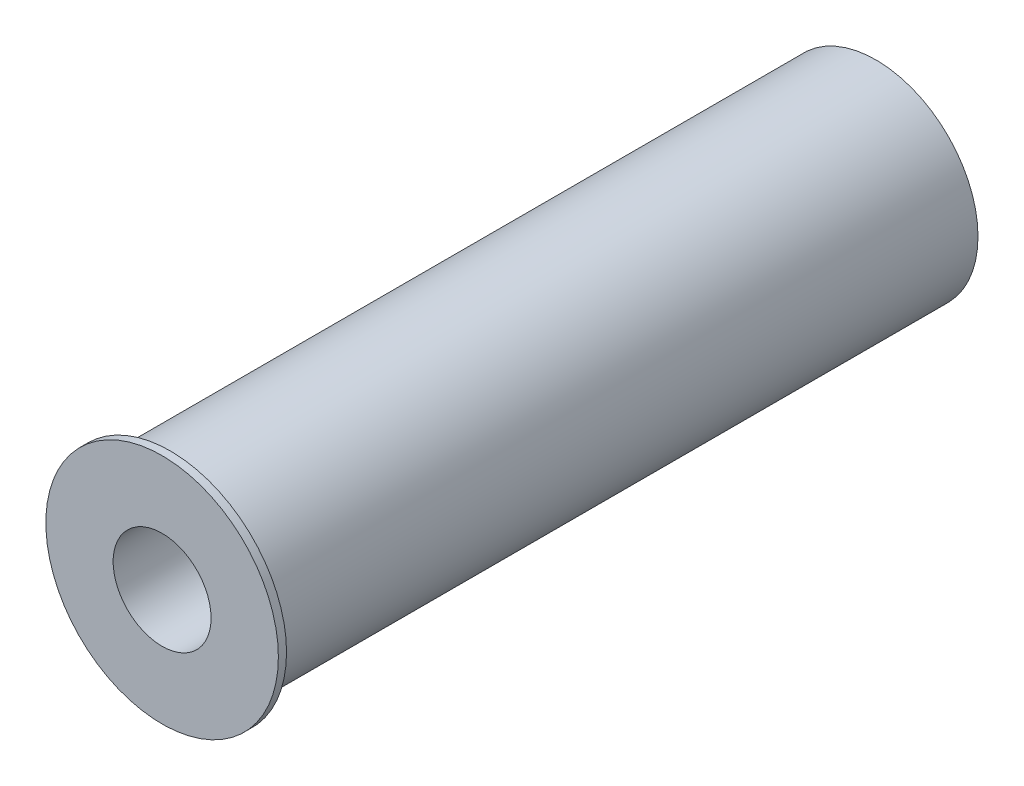
from build123d import *

# Parameters (mm, degrees)
SKIZZE1_R                       = 12.5
SKIZZE1_R_2                     = 6
AUFSATZ_LINEAR_AUSTRAGEN1_DEPTH = 86.5
SKIZZE2_R                       = 14.25
SKIZZE2_R_2                     = 6
AUFSATZ_LINEAR_AUSTRAGEN2_DEPTH = 1
SKIZZE3_R                       = 1.65
SCHNITT_LINEAR_AUSTRAGEN1_DEPTH = 15


with BuildPart() as part:
    # Skizze1 → Aufsatz-Linear austragen1 (new body)
    with BuildSketch(Plane.XY):
        Circle(SKIZZE1_R)
        Circle(SKIZZE1_R_2, mode=Mode.SUBTRACT)
    extrude(amount=AUFSATZ_LINEAR_AUSTRAGEN1_DEPTH)

    # Skizze2 → Aufsatz-Linear austragen2 (add)
    with BuildSketch(Plane.XY.offset(86.5)):
        Circle(SKIZZE2_R)
        Circle(SKIZZE2_R_2, mode=Mode.SUBTRACT)
    extrude(amount=AUFSATZ_LINEAR_AUSTRAGEN2_DEPTH)

    # Skizze3 → Schnitt-Linear austragen1 (cut)
    with BuildSketch(Plane(origin=(0, 0, 0), x_dir=(-1, 0, 0), z_dir=(0, 0, -1))):
        with Locations((9.25, 0)):
            Circle(SKIZZE3_R)
        with Locations((4.625, -8.010734985)):
            Circle(SKIZZE3_R)
        with Locations((-4.625, -8.010734985)):
            Circle(SKIZZE3_R)
        with Locations((-9.25, 0)):
            Circle(SKIZZE3_R)
        with Locations((-4.625, 8.010734985)):
            Circle(SKIZZE3_R)
        with Locations((4.625, 8.010734985)):
            Circle(SKIZZE3_R)
    extrude(amount=-SCHNITT_LINEAR_AUSTRAGEN1_DEPTH, mode=Mode.SUBTRACT)


solid = part.part
